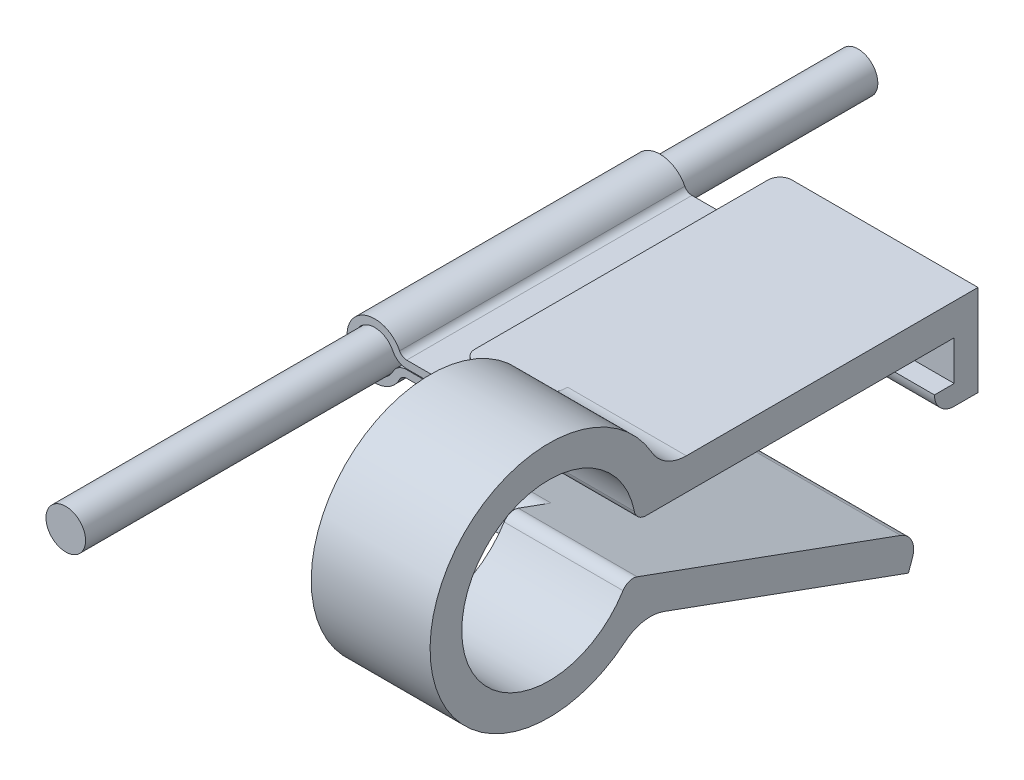
from build123d import *

# Parameters (mm, degrees)
SKETCH1_R           = 0.5
BOSS_EXTRUDE1_DEPTH = 20
EXTRUDE_THIN1_DEPTH = 7.2
BOSS_EXTRUDE2_DEPTH = 3
BOSS_EXTRUDE3_DEPTH = 2
FILLET2_R           = 0.5
FILLET3_R           = 1
FILLET4_R           = 0.3
FILLET5_R           = 0.3


with BuildPart() as part:
    # Sketch1 → Boss-Extrude1 (new body)
    with BuildSketch(Plane.XY):
        Circle(SKETCH1_R)
    extrude(amount=BOSS_EXTRUDE1_DEPTH)


with BuildPart() as body_2:
    # Sketch3 → Extrude-Thin1 (new body)
    with BuildSketch(Plane(origin=(0, 0, 5), x_dir=(-1, 0, 0), z_dir=(0, 0, -1))):
        with BuildLine():
            Line((-4.228476287639893, 0.19999999999999948), (-0.8062257748298554, 0.19999999999999948))
            ThreePointArc((-0.8062257748298554, 0.19999999999999948), (-0.7008165194909093, 0.23003268288024017), (-0.6270644915343319, 0.31111111111111067))
            ThreePointArc((-0.6270644915343319, 0.31111111111111067), (0.7000000000000001, 2e-17), (-0.6270644915343316, -0.31111111111111117))
            ThreePointArc((-0.6270644915343316, -0.31111111111111117), (-0.7008165194909091, -0.23003268288024095), (-0.806225774829855, -0.2000000000000001))
            Line((-0.806225774829855, -0.2000000000000001), (-4.228476287639893, -0.2000000000000005))
            Line((-4.228476287639893, -0.2000000000000005), (-4.228476287639893, -0.01000000000000051))
            Line((-4.228476287639893, -0.01000000000000051), (-0.806225774829855, -0.01000000000000009))
            ThreePointArc((-0.8062257748298561, -0.00999999999999929), (-0.6006777269189111, -0.068563731616469), (-0.4568612724035847, -0.22666666666666638))
            ThreePointArc((-0.4568612724035845, -0.22666666666666677), (0.51, -2e-17), (-0.45686127240358465, 0.22666666666666627))
            ThreePointArc((-0.4568612724035848, 0.22666666666666602), (-0.600677726918911, 0.0685637316164685), (-0.8062257748298558, 0.00999999999999912))
            Line((-0.8062257748298554, 0.00999999999999948), (-4.228476287639893, 0.00999999999999948))
            Line((-4.228476287639893, 0.00999999999999948), (-4.228476287639893, 0.19999999999999948))
        make_face()
    extrude(amount=-EXTRUDE_THIN1_DEPTH)


with BuildPart() as body_3:
    # Sketch5 → Boss-Extrude2 (new body)
    with BuildSketch(Plane(origin=(4.228476287639893, 0, 0), x_dir=(0, 0, -1), z_dir=(1, 0, 0))):
        with BuildLine():
            ThreePointArc((-5.300000000000001, -0.8000000000000005), (-5.153553390593275, -1.1535533905932744), (-4.800000000000001, -1.300000000000001))
            Line((-4.800000000000001, -1.3000000000000007), (-4.2, -1.3000000000000007))
            Line((-4.2, -1.3000000000000007), (-4.2, 1))
            Line((-4.2, 0.9999999999999998), (-12.199999999999998, 0.9999999999999987))
            ThreePointArc((-12.2, 0.9999999999999983), (-17.984505771338654, 0.5413867488476434), (-12.72287206983638, -1.9052525633514834))
            Line((-12.722872069836379, -1.9052525633514832), (-5.957085200177842, -4.367797595296302))
            Line((-5.957085200177842, -4.367797595296302), (-5.683469085517308, -3.6160434986675747))
            Line((-5.683469085517308, -3.6160434986675747), (-13.045883095395867, -0.9363439467272978))
            ThreePointArc((-13.045883095395869, -0.9363439467272983), (-17.196753581769194, 0.4019110383209302), (-12.84016269757365, 0.19999999999999932))
            Line((-12.840162697573648, 0.1999999999999994), (-4.800000000000001, 0.19999999999999948))
            Line((-4.800000000000001, 0.1999999999999995), (-4.800000000000001, -0.8000000000000004))
            Line((-4.800000000000001, -0.8000000000000004), (-5.300000000000001, -0.8000000000000004))
        make_face()
    extrude(amount=BOSS_EXTRUDE2_DEPTH)

    # Sketch5<3> → Boss-Extrude3 (add)
    with BuildSketch(Plane(origin=(4.228476287639893, 0, 0), x_dir=(0, 0, -1), z_dir=(1, 0, 0))):
        Polygon((-4.2, 0.19999999999999948), (-4.2, 0.9999999999999996), (-12.199999999999998, 0.9999999999999987), (-12.2, 0.19999999999999948), align=None)
        Polygon((-12.449255955175843, -1.153498466722756), (-12.722872069836379, -1.9052525633514832), (-5.957085200177842, -4.367797595296302), (-5.683469085517308, -3.6160434986675747), align=None)
    extrude(amount=-BOSS_EXTRUDE3_DEPTH)

    # Fillet2
    fillet2_edges = [body_3.edges().sort_by_distance(p)[0] for p in [
        (4.728476287639893, -3.6160434986675747, 5.683469085517308),
        (3.228476287639893, 0.19999999999999948, 4.2),
        (3.228476287639893, 0.19999999999999948, 12.2),
        (3.228476287639893, -1.153498466722756, 12.449255955175843),
    ]]
    fillet(fillet2_edges, radius=FILLET2_R)

    # Fillet3
    fillet3_edges = [body_3.edges().sort_by_distance(p)[0] for p in [
        (5.728476287639893, 0.9999999999999987, 12.2),
        (5.728476287639893, -1.9052525633514845, 12.72287206983638),
    ]]
    fillet(fillet3_edges, radius=FILLET3_R)

    # Fillet4
    fillet4_edges = [body_3.edges().sort_by_distance(p)[0] for p in [
        (2.228476287639893, 0.8499999999999994, 4.2),
        (2.228476287639893, 0.34644660940672556, 4.346446609406727),
        (2.228476287639893, 0.849999999999999, 12.2),
        (2.228476287639893, 0.3464466094067255, 12.053553390593272),
        (2.228476287639893, -1.764298670233596, 12.671569048337528),
        (2.228476287639893, -1.3412009552602184, 12.361728847316073),
        (2.228476287639893, -4.2268437021784155, 5.905782178678991),
        (2.228476287639893, -3.7035706065273453, 5.87117157405477),
        (2.228476287639893, 0.19999999999999948, 8.2),
        (2.228476287639893, -2.3847709826951657, 9.066362520346575),
    ]]
    fillet(fillet4_edges, radius=FILLET4_R)

    # Fillet5
    fillet5_edges = [body_3.edges().sort_by_distance(p)[0] for p in [
        (5.728476287639893, -0.9363439467272981, 13.045883095395869),
        (5.728476287639893, 0.19999999999999957, 12.84016269757365),
    ]]
    fillet(fillet5_edges, radius=FILLET5_R)


solid = Compound([part.part, body_2.part, body_3.part])
